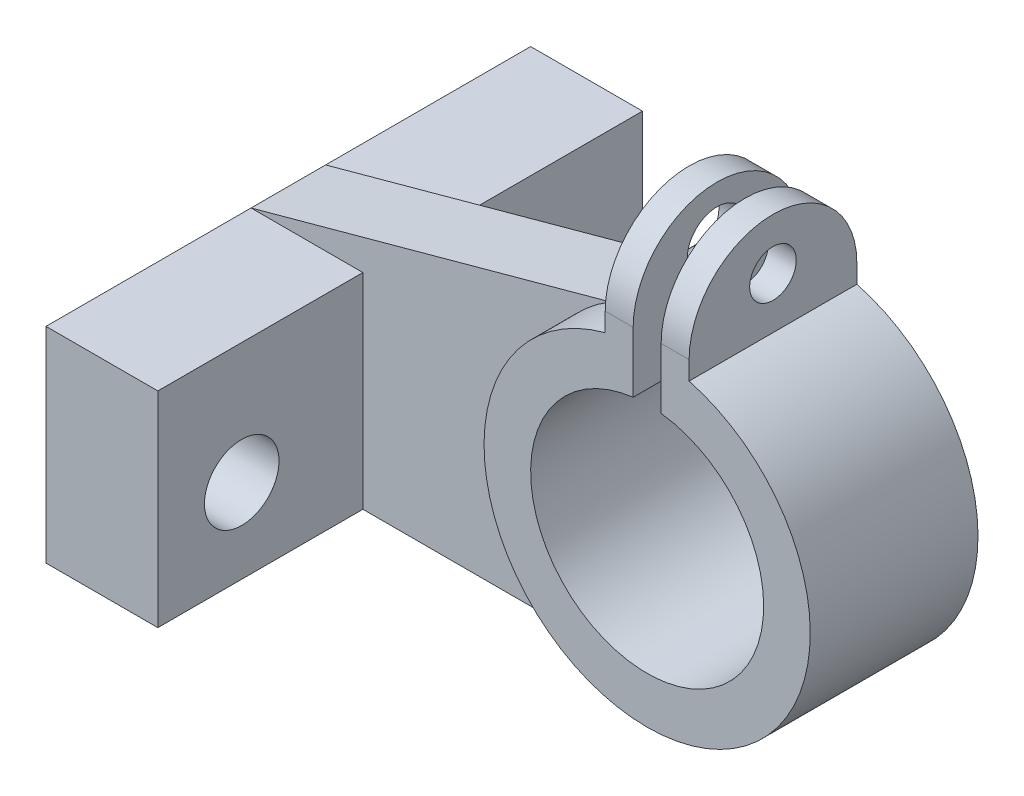
from build123d import *
from OCP.BRepAlgoAPI import BRepAlgoAPI_Cut
from OCP.TopTools import TopTools_ListOfShape
from build123d.topology import SkipClean

# Parameters (mm, degrees)
BOSS_EXTRUDE1_DEPTH      = 26
BOSS_EXTRUDE1_DEPTH_BACK = 26
SKETCH1_W                = 6
SKETCH1_H                = 22
SKETCH2_W                = 17
SKETCH2_H                = 45.409673579
CUT_EXTRUDE1_DEPTH       = 60
SKETCH3_R                = 4
CUT_EXTRUDE2_DEPTH       = 12.000001
SKETCH4_W                = 12
SKETCH4_H                = 22
CUT_EXTRUDE4_DEPTH       = 18
CUT_EXTRUDE5_START       = -5
CUT_EXTRUDE5_DEPTH       = 5
CUT_EXTRUDE6_DEPTH       = 5
SKETCH8_R                = 2.5
CUT_EXTRUDE7_DEPTH       = 3
SKETCH9_W                = 18.588465887
SKETCH9_H                = 5
CUT_EXTRUDE8_DEPTH       = 22
FILLET2_RADIUS           = 9
FILLET2_LENGTH           = 3.00000065
FILLET3_RADIUS           = 9
FILLET3_LENGTH           = 3
CUT_EXTRUDE9_START       = -5
CUT_EXTRUDE9_DEPTH       = 5
BOSS_EXTRUDE2_START      = -5
SKETCH11_R               = 17.5
SKETCH11_R_2             = 12.5
BOSS_EXTRUDE2_DEPTH      = 5
CUT_EXTRUDE10_DEPTH      = 5
SKETCH13_R               = 17.5
SKETCH13_R_2             = 12.5
BOSS_EXTRUDE3_DEPTH      = 5
CUT_EXTRUDE11_START      = -18
SKETCH14_W               = 3
SKETCH14_H               = 6.500000134
CUT_EXTRUDE11_DEPTH      = 18
SKETCH15_R               = 3.2
CUT_EXTRUDE12_DEPTH      = 3.000001


with BuildPart() as part:
    # Sketch1 → Boss-Extrude1 (new, two sides: drawn at the far end of the back side and taken through both)
    with BuildSketch(Plane.XY.offset(-BOSS_EXTRUDE1_DEPTH_BACK)):
        with Locations((-44.500000239, -6.499999432)):
            Rectangle(SKETCH1_W, SKETCH1_H)
        with BuildLine():
            ThreePointArc((-2.39e-07, -17.5), (-16.878212154, -4.623413726), (-8.918281091, 15.057033652))
            Line((-8.918281091, 15.057033652), (-47.500000239, 4.500000568))
            Line((-47.500000239, 4.500000568), (-41.500000239, 4.500000568))
            Line((-41.500000239, 4.500000568), (-41.500000239, -17.499999432))
            Line((-41.500000239, -17.499999432), (-2.39e-07, -17.5))
        make_face()
        with BuildLine():
            Line((-4.500000094, 27.909673713), (-4.500000094, 16.9115345))
            ThreePointArc((-4.500000094, 16.9115345), (-2.39e-07, -17.5), (4.500000556, 16.911534377))
            Line((4.500000556, 16.911534377), (4.500000556, 27.909673579))
            Line((4.500000556, 27.909673579), (1.500000556, 27.909673579))
            Line((1.500000556, 27.909673579), (1.500000556, 12.409673579))
            ThreePointArc((1.500000556, 12.409673579), (-5.6e-07, -12.5), (-1.499999444, 12.409673713))
            Line((-1.499999444, 12.409673713), (-1.499999444, 27.909673713))
            Line((-1.499999444, 27.909673713), (-4.500000094, 27.909673713))
        make_face()
    extrude(amount=BOSS_EXTRUDE1_DEPTH + BOSS_EXTRUDE1_DEPTH_BACK)

    # Sketch2 → Cut-Extrude1 (cut)
    with BuildSketch(Plane(origin=(24.500000556, 0, 0), x_dir=(0, 0, -1), z_dir=(1, 0, 0))):
        with Locations((-17.5, 5.20483679)):
            Rectangle(SKETCH2_W, SKETCH2_H)
        with Locations((17.5, 5.20483679)):
            Rectangle(SKETCH2_W, SKETCH2_H)
    extrude(amount=-CUT_EXTRUDE1_DEPTH, mode=Mode.SUBTRACT)

    # Sketch3 → Cut-Extrude2 (cut)
    with BuildSketch(Plane.ZY.offset(47.500000239)):
        with Locations((-17, -8.499999432)):
            Circle(SKETCH3_R)
        with Locations((17, -8.499999432)):
            Circle(SKETCH3_R)
    extrude(amount=-CUT_EXTRUDE2_DEPTH, mode=Mode.SUBTRACT)


with BuildPart() as cut_extrude4_tool:
    # Sketch4 → Cut-Extrude4 (new body)
    with BuildSketch(Plane(origin=(3.08e-07, 22.5, 0), x_dir=(-0.9999999999999999, 1.3684242577770874e-08, 0), z_dir=(-1.3684242577770874e-08, -0.9999999999999999, 0))):
        with Locations((41.500000301, 15)):
            Rectangle(SKETCH4_W, SKETCH4_H)
        with Locations((41.500000301, -15)):
            Rectangle(SKETCH4_W, SKETCH4_H)
    extrude(amount=CUT_EXTRUDE4_DEPTH)


with BuildPart() as part_1:
    add(part.part)

    # Cut-Extrude4: cut by cut_extrude4_tool, with a tolerance
    cut_extrude4_stock = TopTools_ListOfShape()
    cut_extrude4_stock.Append(part_1.part.wrapped)
    cut_extrude4_tools = TopTools_ListOfShape()
    cut_extrude4_tools.Append(cut_extrude4_tool.part.wrapped)
    cut_extrude4_cut = BRepAlgoAPI_Cut()
    cut_extrude4_cut.SetArguments(cut_extrude4_stock)
    cut_extrude4_cut.SetTools(cut_extrude4_tools)
    cut_extrude4_cut.SetFuzzyValue(0.00001)
    cut_extrude4_cut.Build()
    add(Compound.cast(cut_extrude4_cut.Shape()).solids(), mode=Mode.REPLACE)

    # Sketch5 → Cut-Extrude5 (cut)
    with BuildSketch(Plane.XY.offset(9).offset(CUT_EXTRUDE5_START)):
        with BuildLine():
            Line((-47.500000239, 4.50000065), (-16.911534352, 4.50000065))
            ThreePointArc((-16.911534352, 4.50000065), (-13.951973972, 10.563731456), (-8.918281071, 15.057033663))
            Line((-8.918281071, 15.057033663), (-47.500000239, 4.50000065))
        make_face()
    extrude(amount=CUT_EXTRUDE5_DEPTH, mode=Mode.SUBTRACT)

    # Sketch7 → Cut-Extrude6 (cut)
    with BuildSketch(Plane(origin=(0, 0, -9), x_dir=(-1, 0, 0), z_dir=(0, 0, -1))):
        with BuildLine():
            Line((47.500000239, 4.50000065), (16.911534352, 4.50000065))
            ThreePointArc((16.911534352, 4.50000065), (13.951973972, 10.563731456), (8.918281071, 15.057033663))
            Line((8.918281071, 15.057033663), (47.500000239, 4.50000065))
        make_face()
    extrude(amount=-CUT_EXTRUDE6_DEPTH, mode=Mode.SUBTRACT)

    # Sketch8 → Cut-Extrude7 (cut)
    with BuildSketch(Plane(origin=(4.500000556, 0, 0), x_dir=(0, 0, -1), z_dir=(1, 0, 0))):
        with Locations(Location((0, 22.410603978, 0), (0, 0, 90))):
            Circle(SKETCH8_R)
    extrude(amount=-CUT_EXTRUDE7_DEPTH, mode=Mode.SUBTRACT)


with BuildPart() as cut_extrude8_tool:
    # Sketch9 → Cut-Extrude8 (new body)
    with BuildSketch(Plane(origin=(6.2e-08, 4.5, 0), x_dir=(1.0, -1.3684242685755665e-08, 0), z_dir=(1.3684242685755665e-08, 1.0, 0))):
        with Locations((-26.205767358, 6.5)):
            Rectangle(SKETCH9_W, SKETCH9_H)
        with Locations((-26.205767358, -6.5)):
            Rectangle(SKETCH9_W, SKETCH9_H)
    extrude(amount=-CUT_EXTRUDE8_DEPTH)


with BuildPart() as part_2:
    add(part_1.part)

    # Cut-Extrude8: cut by cut_extrude8_tool, with a tolerance
    cut_extrude8_stock = TopTools_ListOfShape()
    cut_extrude8_stock.Append(part_2.part.wrapped)
    cut_extrude8_tools = TopTools_ListOfShape()
    cut_extrude8_tools.Append(cut_extrude8_tool.part.wrapped)
    cut_extrude8_cut = BRepAlgoAPI_Cut()
    cut_extrude8_cut.SetArguments(cut_extrude8_stock)
    cut_extrude8_cut.SetTools(cut_extrude8_tools)
    cut_extrude8_cut.SetFuzzyValue(0.00001)
    cut_extrude8_cut.Build()
    add(Compound.cast(cut_extrude8_cut.Shape()).solids(), mode=Mode.REPLACE)

    # Fillet2: full round fillet: the end face becomes a half cylinder, R = half its width
    fillet2_face = Plane((-2.999999769, 27.909673579, 0), x_dir=(-1, 0, 0), z_dir=(0, 1, 0))  # on the end face: x along it, z out of the body
    fillet2_slab = fillet2_face.offset(-FILLET2_RADIUS / 2) * Box(FILLET2_LENGTH, 2 * FILLET2_RADIUS, FILLET2_RADIUS, mode=Mode.PRIVATE)  # the body's end, R deep
    fillet2_round = Plane((-2.999999769, 18.909673579, 0), x_dir=(0, 1, 0), z_dir=(-1, 0, 0)) * Cylinder(FILLET2_RADIUS, FILLET2_LENGTH, mode=Mode.PRIVATE)  # its axis R under the face
    add(fillet2_slab - fillet2_round, mode=Mode.SUBTRACT)

    # Fillet3: full round fillet: the end face becomes a half cylinder, R = half its width
    fillet3_face = Plane((3.000000556, 27.909673579, 0), x_dir=(-1, 0, 0), z_dir=(0, 1, 0))  # on the end face: x along it, z out of the body
    fillet3_slab = fillet3_face.offset(-FILLET3_RADIUS / 2) * Box(FILLET3_LENGTH, 2 * FILLET3_RADIUS, FILLET3_RADIUS, mode=Mode.PRIVATE)  # the body's end, R deep
    fillet3_round = Plane((3.000000556, 18.909673579, 0), x_dir=(0, 1, 0), z_dir=(-1, 0, 0)) * Cylinder(FILLET3_RADIUS, FILLET3_LENGTH, mode=Mode.PRIVATE)  # its axis R under the face
    add(fillet3_slab - fillet3_round, mode=Mode.SUBTRACT)

    # Sketch10 → Cut-Extrude9 (cut)
    with BuildSketch(Plane.XY.offset(9).offset(CUT_EXTRUDE9_START)):
        with BuildLine():
            Line((0, -17.5), (-16.911534475, -17.5))
            Line((-16.911534475, -17.5), (-16.911534475, -4.500000187))
            ThreePointArc((-16.911534475, -4.500000187), (-10.665364427, -13.874436985), (0, -17.5))
        make_face()
    extrude(amount=CUT_EXTRUDE9_DEPTH, mode=Mode.SUBTRACT)

    # Sketch11 → Boss-Extrude2 (add)
    with BuildSketch(Plane.XY.offset(9).offset(BOSS_EXTRUDE2_START)):
        Circle(SKETCH11_R)
        with Locations(Location((0, 0, 0), (0, 0, 83.107894852))):
            Circle(SKETCH11_R_2, mode=Mode.SUBTRACT)
    extrude(amount=BOSS_EXTRUDE2_DEPTH)

    # Sketch12 → Cut-Extrude10 (cut)
    with BuildSketch(Plane(origin=(0, 0, -9), x_dir=(-1, 0, 0), z_dir=(0, 0, -1))):
        with BuildLine():
            Line((0, -17.5), (16.911534475, -17.5))
            Line((16.911534475, -17.5), (16.911534475, -4.500000187))
            ThreePointArc((16.911534475, -4.500000187), (10.665364427, -13.874436985), (0, -17.5))
        make_face()
    extrude(amount=-CUT_EXTRUDE10_DEPTH, mode=Mode.SUBTRACT)

    # Sketch13 → Boss-Extrude3 (add)
    with BuildSketch(Plane(origin=(0, 0, -9), x_dir=(-1, 0, 0), z_dir=(0, 0, -1))):
        Circle(SKETCH13_R)
        with Locations(Location((0, 0, 0), (0, 0, 180))):
            Circle(SKETCH13_R_2, mode=Mode.SUBTRACT)
    extrude(amount=-BOSS_EXTRUDE3_DEPTH)

    # Sketch14 → Cut-Extrude11 (cut)
    with SkipClean():  # the faces are left unmerged after this step: merging them gives an invalid solid
        with BuildSketch(Plane.XY.offset(9).offset(CUT_EXTRUDE11_START)):
            with Locations((5.56e-07, 15.659673646)):
                Rectangle(SKETCH14_W, SKETCH14_H)
        extrude(amount=CUT_EXTRUDE11_DEPTH, mode=Mode.SUBTRACT)

    # Sketch15 → Cut-Extrude12 (cut)
    with SkipClean():  # the faces are left unmerged after this step: merging them gives an invalid solid
        with BuildSketch(Plane.ZY.offset(4.500000094)):
            with Locations((0, 22.41060404)):
                Circle(SKETCH15_R)
        extrude(amount=-CUT_EXTRUDE12_DEPTH, mode=Mode.SUBTRACT)


solid = part_2.part
